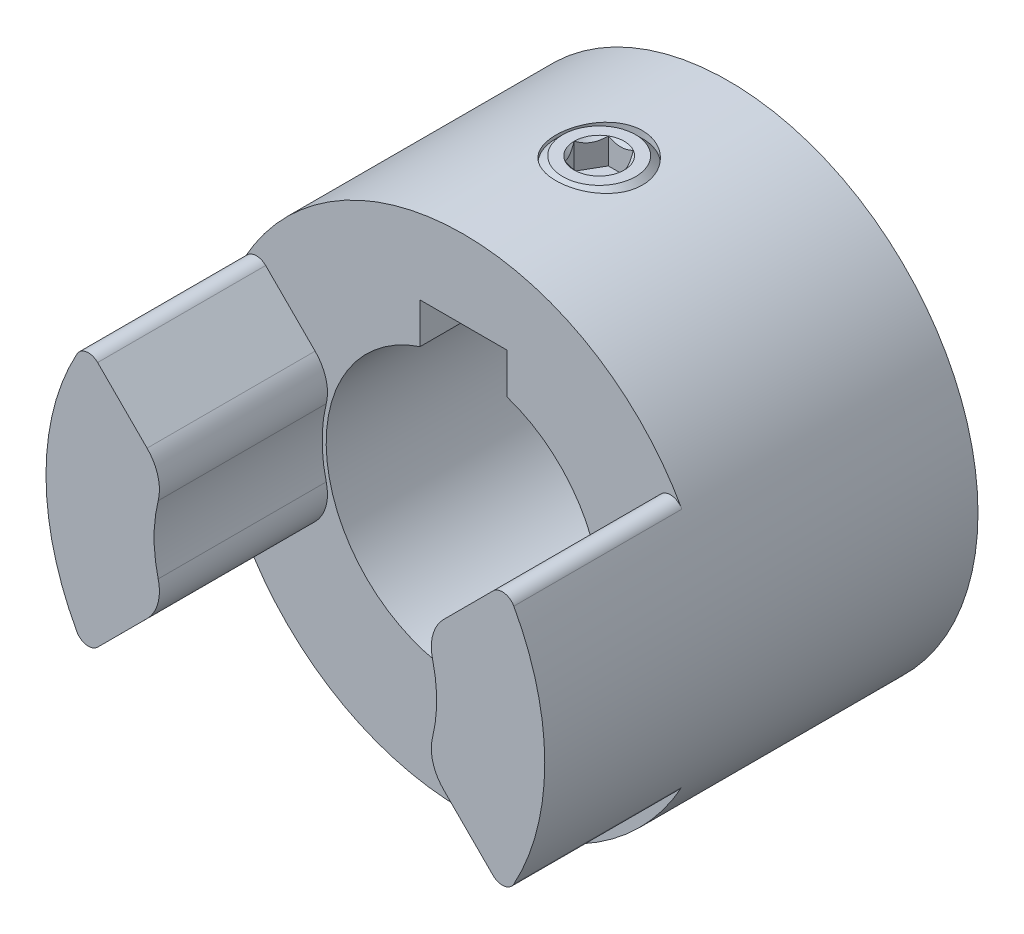
from build123d import *
from OCP.BRepFilletAPI import BRepFilletAPI_MakeChamfer
from build123d.topology import SkipClean

# Parameters (mm, degrees)
BOSS_EXTRUDE1_START     = -6.151562
SKETCH1_R               = 17.264063
BOSS_EXTRUDE1_DEPTH     = 19.050001
BOSS_EXTRUDE6_START     = 11.6332
BOSS_EXTRUDE6_DEPTH     = 11.6332
MOVE_START              = -6.151562
MOVE_FACE2_DEPTH        = 11.6332
MOVE_FACE2_2_DEPTH      = 11.6332
CIRPATTERN4_START       = -6.151562
CIRPATTERN4_DEPTH       = 11.6332
CUT_EXTRUDE5_DEPTH      = 36.088666
CUT_EXTRUDE5_DEPTH_BACK = 36.088666
SKETCH15_R              = 9.5
CHAMFER1_SIZE           = 0.690562
CHAMFER1_SIZE2          = 1.023801
CUT_EXTRUDE1_DEPTH      = 36.088666
CUT_EXTRUDE1_DEPTH_BACK = 36.088666
SKETCH5_R               = 3
CUT_EXTRUDE2_DEPTH      = 36.088666
SKETCH6_R               = 3
BOSS_EXTRUDE3_DEPTH     = 5
CUT_EXTRUDE3_DEPTH      = 1.8
CHAMFER3_SIZE           = 0.48
CHAMFER4_SIZE           = 1.02


# Read off the part's stored shape, not the designer's step: Move Face2, CirPattern4
with BuildPart() as part:
    # Sketch1 → Boss-Extrude1 (new body)
    with BuildSketch(Plane.XY.offset(BOSS_EXTRUDE1_START)):
        Circle(SKETCH1_R)
    extrude(amount=-BOSS_EXTRUDE1_DEPTH)

    # Sketch12 → Boss-Extrude6 (add)
    with SkipClean():  # the faces are left unmerged after this step: merging them gives an invalid solid
        with BuildSketch(Plane.XY.offset(-6.151562).offset(BOSS_EXTRUDE6_START)):
            with BuildLine():
                Line((-5.109669, -10.267035), (-8.53299, -13.689402))
                ThreePointArc((-8.53299, -13.689402), (-8.789079, -14.456186), (-8.329891, -15.121533))
                ThreePointArc((-8.329891, -15.121533), (0, -17.264062), (8.329891, -15.121533))
                ThreePointArc((8.329891, -15.121533), (8.789079, -14.456186), (8.53299, -13.689402))
                Line((8.53299, -13.689402), (5.109669, -10.267035))
                ThreePointArc((5.109669, -10.267035), (3.828066, -9.5188), (2.344193, -9.496817))
                ThreePointArc((2.344193, -9.496817), (0, -9.78186), (-2.344193, -9.496817))
                ThreePointArc((-2.344193, -9.496817), (-3.828066, -9.5188), (-5.109669, -10.267035))
            make_face()
        extrude(amount=-BOSS_EXTRUDE6_DEPTH)

    # Move Face2 outline → Move Face2 (cut)
    with BuildSketch(Plane.XY.offset(MOVE_START)):
        with BuildLine():
            ThreePointArc((-8.329891, -15.121533), (0, -17.264063), (8.329891, -15.121533))
            ThreePointArc((8.329891, -15.121533), (8.789079, -14.456186), (8.53299, -13.689402))
            Line((8.53299, -13.689402), (5.109669, -10.267035))
            ThreePointArc((5.109669, -10.267035), (3.828066, -9.5188), (2.344193, -9.496817))
            ThreePointArc((2.344193, -9.496817), (0, -9.78186), (-2.344193, -9.496817))
            ThreePointArc((-2.344193, -9.496817), (-3.828066, -9.5188), (-5.109669, -10.267035))
            Line((-5.109669, -10.267035), (-8.53299, -13.689402))
            ThreePointArc((-8.53299, -13.689402), (-8.789079, -14.456186), (-8.329891, -15.121533))
        make_face()
    extrude(amount=MOVE_FACE2_DEPTH, mode=Mode.SUBTRACT)

    # Move Face2 2 outline → Move Face2 2 (add)
    with BuildSketch(Plane.XY.offset(MOVE_START)):
        with BuildLine():
            ThreePointArc((9.496817, -2.344193), (9.5188, -3.828066), (10.267035, -5.109669))
            Line((10.267035, -5.109669), (13.689402, -8.53299))
            ThreePointArc((13.689402, -8.53299), (14.456186, -8.789079), (15.121533, -8.329891))
            ThreePointArc((15.121533, -8.329891), (17.264063, 0), (15.121533, 8.329891))
            ThreePointArc((15.121533, 8.329891), (14.456186, 8.789079), (13.689402, 8.53299))
            Line((13.689402, 8.53299), (10.267035, 5.109669))
            ThreePointArc((10.267035, 5.109669), (9.5188, 3.828066), (9.496817, 2.344193))
            ThreePointArc((9.496817, 2.344193), (9.78186, 0), (9.496817, -2.344193))
        make_face()
    extrude(amount=MOVE_FACE2_2_DEPTH)

    # CirPattern4 outline → CirPattern4 (add)
    with BuildSketch(Plane.XY.offset(CIRPATTERN4_START)):
        with BuildLine():
            ThreePointArc((-9.496817, 2.344193), (-9.5188, 3.828066), (-10.267035, 5.109669))
            Line((-10.267035, 5.109669), (-13.689402, 8.53299))
            ThreePointArc((-13.689402, 8.53299), (-14.456186, 8.789079), (-15.121533, 8.329891))
            ThreePointArc((-15.121533, 8.329891), (-17.264063, 0), (-15.121533, -8.329891))
            ThreePointArc((-15.121533, -8.329891), (-14.456186, -8.789079), (-13.689402, -8.53299))
            Line((-13.689402, -8.53299), (-10.267035, -5.109669))
            ThreePointArc((-10.267035, -5.109669), (-9.5188, -3.828066), (-9.496817, -2.344193))
            ThreePointArc((-9.496817, -2.344193), (-9.78186, 0), (-9.496817, 2.344193))
        make_face()
    extrude(amount=CIRPATTERN4_DEPTH)

    # Sketch15 → Cut-Extrude5 (cut, two sides: drawn at the far end of the back side and taken through both)
    with BuildSketch(Plane.XY.offset(-CUT_EXTRUDE5_DEPTH_BACK)):
        Circle(SKETCH15_R)
    extrude(amount=CUT_EXTRUDE5_DEPTH + CUT_EXTRUDE5_DEPTH_BACK, mode=Mode.SUBTRACT)

    # Chamfer1: one chamfer whose edges measure the first distance from different faces: ONE call of the kernel's chamfer builder (chamfer() names one face for all edges)
    chamfer1_edges_1 = [part.edges().sort_by_distance(p)[0] for p in [
        (-17.264063, 0, -25.201563),
    ]]
    chamfer1_side_1 = [part.faces().sort_by_distance(p)[0] for p in [
        (-17.264063, 0, -15.676563),
    ]]
    chamfer1_edges_2 = [part.edges().sort_by_distance(p)[0] for p in [
        (-9.5, 0, -25.201563),
    ]]
    chamfer1_side_2 = [part.faces().sort_by_distance(p)[0] for p in [
        (-9.5, 0, -15.676562),
    ]]
    chamfer1 = BRepFilletAPI_MakeChamfer(part.part.solid().wrapped)
    for e in chamfer1_edges_1:
        chamfer1.Add(CHAMFER1_SIZE, CHAMFER1_SIZE2, e.wrapped, chamfer1_side_1[0].wrapped)  # the first distance lies on this face
    for e in chamfer1_edges_2:
        chamfer1.Add(CHAMFER1_SIZE, CHAMFER1_SIZE2, e.wrapped, chamfer1_side_2[0].wrapped)  # the first distance lies on this face
    add(Compound.cast(chamfer1.Shape()), mode=Mode.REPLACE)

    # Sketch4 → Cut-Extrude1 (cut, two sides: drawn at the far end of the back side and taken through both)
    with BuildSketch(Plane.XY.offset(-CUT_EXTRUDE1_DEPTH_BACK)):
        with BuildLine():
            Line((-3, 11.813878), (3, 11.813878))
            Line((3, 11.813878), (3, 9.013878))
            ThreePointArc((3, 9.013878), (0, 9.5), (-3, 9.013878))
            Line((-3, 9.013878), (-3, 11.813878))
        make_face()
    extrude(amount=CUT_EXTRUDE1_DEPTH + CUT_EXTRUDE1_DEPTH_BACK, mode=Mode.SUBTRACT)

    # Sketch5 → Cut-Extrude2 (cut, through all)
    with BuildSketch(Plane(origin=(0, 0, 0), x_dir=(1, 0, 0), z_dir=(0, 1, 0))):
        with Locations(Location((0, 15.549563, 0), (0, 0, 90))):
            Circle(SKETCH5_R)
    extrude(amount=CUT_EXTRUDE2_DEPTH, mode=Mode.SUBTRACT)


with BuildPart() as body_2:
    # Sketch6 → Boss-Extrude3 (new body)
    with BuildSketch(Plane(origin=(0, 17.264063, 0), x_dir=(-1, 0, 0), z_dir=(0, 1, 0))):
        with Locations(Location((0, -15.549563, 0), (0, 0, 90))):
            Circle(SKETCH6_R)
    extrude(amount=-BOSS_EXTRUDE3_DEPTH)

    # Sketch8 → Cut-Extrude3 (cut)
    with BuildSketch(Plane(origin=(0, 17.264063, 0), x_dir=(1, 0, 0), z_dir=(0, 1, 0))):
        Polygon((0.866025, 14.049563), (1.732051, 15.549563), (0.866025, 17.049563), (-0.866025, 17.049563), (-1.732051, 15.549563), (-0.866025, 14.049563), align=None)
    extrude(amount=-CUT_EXTRUDE3_DEPTH, mode=Mode.SUBTRACT)

    # Cut-Extrude4 cone 1 section (through the dimple's axis) → Cut-Extrude4 (revolve, cut)
    with BuildSketch(Plane(origin=(0, 17.264063, -15.549563), x_dir=(0, 0, 1), z_dir=(1, 0, 0))):
        Polygon((0, 0), (1.732051, 0), (0, 1.732051), align=None)
    revolve(axis=Axis((0, 17.264063, -15.549563), (0, -1, 0)), mode=Mode.SUBTRACT)

    # Chamfer3
    chamfer3_edges = [body_2.edges().sort_by_distance(p)[0] for p in [
        (0, 17.264063, -18.549563),
    ]]
    chamfer(chamfer3_edges, length=CHAMFER3_SIZE)

    # Chamfer4
    chamfer4_edges = [body_2.edges().sort_by_distance(p)[0] for p in [
        (0, 12.264063, -18.549563),
    ]]
    chamfer(chamfer4_edges, length=CHAMFER4_SIZE)


solid = Compound([part.part, body_2.part])
